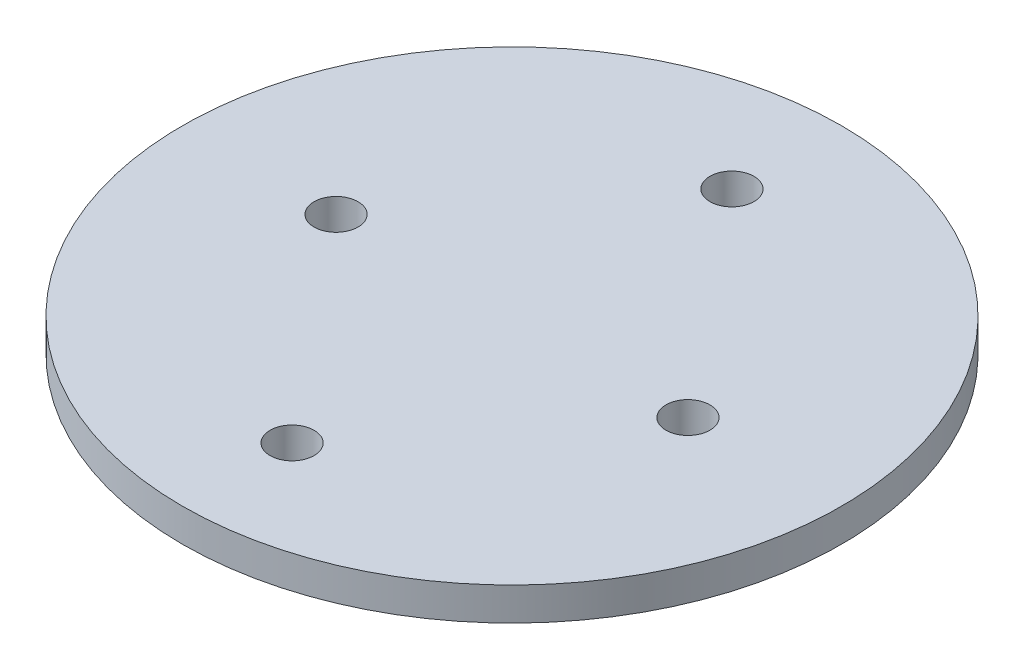
from build123d import *

# Parameters (mm, degrees)
SKETCH1_R           = 47.575
BOSS_EXTRUDE1_DEPTH = 4.7625
SKETCH2_R           = 3.175
CUT_EXTRUDE1_DEPTH  = 68.449556383


with BuildPart() as part:
    # Sketch1 → Boss-Extrude1 (new body)
    with BuildSketch(Plane(origin=(0, 0, 0), x_dir=(1, 0, 0), z_dir=(0, 1, 0))):
        Circle(SKETCH1_R)
    extrude(amount=BOSS_EXTRUDE1_DEPTH)

    # Sketch2 → Cut-Extrude1 (cut, through all)
    with BuildSketch(Plane(origin=(0, 4.7625, 0), x_dir=(1, 0, 0), z_dir=(0, 1, 0))):
        with Locations((25.4, 0)):
            Circle(SKETCH2_R)
        with Locations((-25.4, 0)):
            Circle(SKETCH2_R)
        with Locations((0, 31.75)):
            Circle(SKETCH2_R)
        with Locations((0, -31.75)):
            Circle(SKETCH2_R)
    extrude(amount=-CUT_EXTRUDE1_DEPTH, mode=Mode.SUBTRACT)


solid = part.part
